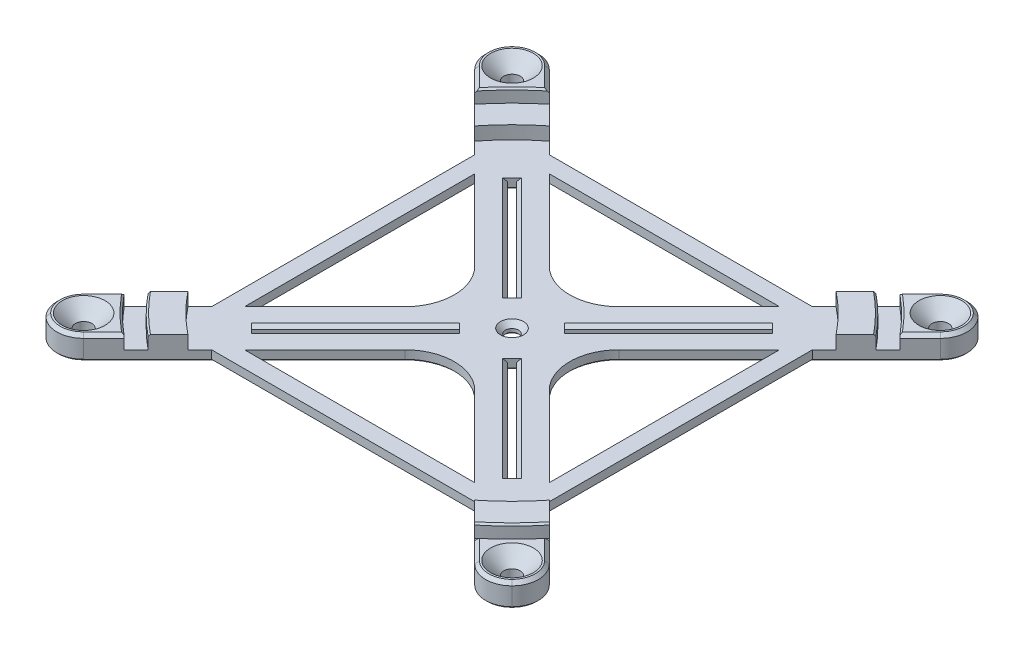
from build123d import *

# Parameters (mm, degrees)
EXTRUDE_1_DEPTH       = 14
EXTRUDE_2_DEPTH       = 14
FILLET_1_R            = 16
SKETCH_3_R            = 5
SKETCH_3_R_2          = 4
CUT_EXTRUDE_1_DEPTH   = 208.101215987
FILLET_2_R            = 30
SKETCH_4_R            = 167.2
SKETCH_4_R_2          = 157
CUT_EXTRUDE_1_2_DEPTH = 8
CHAMFER_2_SIZE        = 1
SKETCH_5_R            = 140
CUT_EXTRUDE_2_DEPTH   = 8
CHAMFER_3_SIZE        = 8
CHAMFER_4_SIZE        = 2
CHAMFER_5_SIZE        = 3
CUT_EXTRUDE_4_DEPTH   = 207.782285661
CHAMFER_6_SIZE        = 2
SKETCH_9_W            = 172.613296279
SKETCH_9_H            = 10
SKETCH_9_W_2          = 10
SKETCH_9_H_2          = 172.613296279
EXTRUDE_3_DEPTH       = 6
CHAMFER_7_SIZE        = 1


with BuildPart() as part:
    # Эскиз1 → Бобышка-Вытянуть1 (new body)
    with BuildSketch(Plane(origin=(0, 0, 0), x_dir=(1, 0, 0), z_dir=(0, 1, 0))):
        Polygon((130.107647738, -152.735064736), (-152.735064736, 130.107647738), (-130.107647738, 152.735064736), (152.735064736, -130.107647738), align=None)
    extrude(amount=EXTRUDE_1_DEPTH)

    # Эскиз2 → Бобышка-Вытянуть2 (add)
    with BuildSketch(Plane(origin=(0, 0, 0), x_dir=(1, 0, 0), z_dir=(0, 1, 0))):
        Polygon((-152.735064736, -130.107647738), (130.107647738, 152.735064736), (152.735064736, 130.107647738), (-130.107647738, -152.735064736), align=None)
    extrude(amount=EXTRUDE_2_DEPTH)

    # Скругление1
    fillet_1_edges = [part.edges().sort_by_distance(p)[0] for p in [
        (-130.107647738, 7, -152.735064736),
        (-152.735064736, 7, -130.107647738),
        (130.107647738, 7, 152.735064736),
        (152.735064736, 7, 130.107647738),
        (-130.107647738, 7, 152.735064736),
        (-152.735064736, 7, 130.107647738),
        (130.107647738, 7, -152.735064736),
        (152.735064736, 7, -130.107647738),
    ]]
    fillet(fillet_1_edges, radius=FILLET_1_R - 0.0001)  # a hair under: the kernel refuses the full size

    # Эскиз3 → Cut-Extrude 1 (cut, through all)
    with BuildSketch(Plane(origin=(0, 14, 0), x_dir=(1, 0, 0), z_dir=(0, 1, 0))):
        with Locations(Location((-130, -130, 0), (0, 0, 270))):
            Circle(SKETCH_3_R)
        with Locations(Location((-130, 130, 0), (0, 0, 270))):
            Circle(SKETCH_3_R)
        with Locations(Location((130, 130, 0), (0, 0, 270))):
            Circle(SKETCH_3_R)
        with Locations(Location((130, -130, 0), (0, 0, 270))):
            Circle(SKETCH_3_R)
        with Locations(Location((0, 0, 0), (0, 0, 270))):
            Circle(SKETCH_3_R_2)
    extrude(amount=-CUT_EXTRUDE_1_DEPTH, mode=Mode.SUBTRACT)

    # Скругление2
    fillet_2_edges = [part.edges().sort_by_distance(p)[0] for p in [
        (22.627416998, 7, 0),
        (0, 7, 22.627416998),
        (0, 7, -22.627416998),
        (-22.627416998, 7, 0),
    ]]
    fillet(fillet_2_edges, radius=FILLET_2_R)

    # Эскиз4 → Cut-Extrude 1 2 (cut)
    with BuildSketch(Plane(origin=(0, 14, 0), x_dir=(1, 0, 0), z_dir=(0, 1, 0))):
        Circle(SKETCH_4_R)
        Circle(SKETCH_4_R_2, mode=Mode.SUBTRACT)
    extrude(amount=-CUT_EXTRUDE_1_2_DEPTH, mode=Mode.SUBTRACT)

    # Фаска2
    chamfer_2_edges = [part.edges().sort_by_distance(p)[0] for p in [
        (118.228253814, 14, 118.228253814),
        (-118.228253814, 14, -118.228253814),
        (-118.228253814, 14, 118.228253814),
        (118.228253814, 14, -118.228253814),
        (111.015764646, 14, 111.015764646),
        (-111.015764646, 14, -111.015764646),
        (-111.015764646, 14, 111.015764646),
        (111.015764646, 14, -111.015764646),
    ]]
    chamfer(chamfer_2_edges, length=CHAMFER_2_SIZE)

    # Эскиз5 → Вырез-Вытянуть2 (cut)
    with BuildSketch(Plane(origin=(0, 14, 0), x_dir=(1, 0, 0), z_dir=(0, 1, 0))):
        Circle(SKETCH_5_R)
    extrude(amount=-CUT_EXTRUDE_2_DEPTH, mode=Mode.SUBTRACT)

    # Фаска3
    chamfer_3_edges = [part.edges().sort_by_distance(p)[0] for p in [
        (130, 14, 125),
        (130, 14, -135),
        (-130, 14, -135),
        (-130, 14, 125),
    ]]
    chamfer(chamfer_3_edges, length=CHAMFER_3_SIZE)

    # Фаска4
    chamfer_4_edges = [part.edges().sort_by_distance(p)[0] for p in [
        (-112.938165895, 14, -135.565582893),
        (-130.107647738, 14, -146.10768916),
        (-135.565582893, 14, -112.938165895),
        (-146.10768916, 14, -130.107647738),
        (112.938165895, 14, -135.565582893),
        (135.565582893, 14, -112.938165895),
        (130.107647738, 14, -146.10768916),
        (146.10768916, 14, -130.107647738),
        (-135.565582893, 14, 112.938165895),
        (-146.10768916, 14, 130.107647738),
        (-112.938165895, 14, 135.565582893),
        (-130.107647738, 14, 146.10768916),
        (112.938165895, 14, 135.565582893),
        (130.107647738, 14, 146.10768916),
        (135.565582893, 14, 112.938165895),
        (146.10768916, 14, 130.107647738),
    ]]
    chamfer(chamfer_4_edges, length=CHAMFER_4_SIZE)

    # Фаска5
    chamfer_5_edges = [part.edges().sort_by_distance(p)[0] for p in [
        (0, 6, -4),
    ]]
    chamfer(chamfer_5_edges, length=CHAMFER_5_SIZE)

    # Эскиз8 → Вырез-Вытянуть4 (cut, through all)
    with BuildSketch(Plane(origin=(0, 6, 0), x_dir=(1, 0, 0), z_dir=(0, 1, 0))):
        Polygon((14.516290338, 17.344717463), (77.659021124, 80.487448249), (80.487448249, 77.659021124), (17.344717463, 14.516290338), align=None)
        Polygon((17.344717463, -14.516290338), (80.487448249, -77.659021124), (77.659021124, -80.487448249), (14.516290338, -17.344717463), align=None)
        Polygon((-14.516290338, -17.344717463), (-77.659021124, -80.487448249), (-80.487448249, -77.659021124), (-17.344717463, -14.516290338), align=None)
        Polygon((-17.344717463, 14.516290338), (-80.487448249, 77.659021124), (-77.659021124, 80.487448249), (-14.516290338, 17.344717463), align=None)
    extrude(amount=-CUT_EXTRUDE_4_DEPTH, mode=Mode.SUBTRACT)

    # Фаска6
    chamfer_6_edges = [part.edges().sort_by_distance(p)[0] for p in [
        (-46.087655731, 6, -48.916082856),
        (-48.916082856, 6, -46.087655731),
        (-48.916082856, 6, 46.087655731),
        (-46.087655731, 6, 48.916082856),
        (46.087655731, 6, 48.916082856),
        (48.916082856, 6, 46.087655731),
        (48.916082856, 6, -46.087655731),
        (46.087655731, 6, -48.916082856),
    ]]
    chamfer(chamfer_6_edges, length=CHAMFER_6_SIZE)

    # Эскиз9 → Бобышка-Вытянуть3 (add)
    with BuildSketch(Plane(origin=(0, 6, 0), x_dir=(1, 0, 0), z_dir=(0, 1, 0))):
        with Locations((0.14392075, 97.496971679)):
            Rectangle(SKETCH_9_W, SKETCH_9_H)
        with Locations((97.496971679, -0.14392075)):
            Rectangle(SKETCH_9_W_2, SKETCH_9_H_2)
        with Locations((-0.14392075, -97.496971679)):
            Rectangle(SKETCH_9_W, SKETCH_9_H)
        with Locations((-97.496971679, 0.14392075)):
            Rectangle(SKETCH_9_W_2, SKETCH_9_H_2)
    extrude(amount=-EXTRUDE_3_DEPTH)

    # Фаска7
    chamfer_7_edges = [part.edges().sort_by_distance(p)[0] for p in [
        (68.168796056, 0, -45.541379058),
        (45.541379058, 0, 68.168796056),
        (-68.168796056, 0, 45.541379058),
        (-45.541379058, 0, -68.168796056),
        (35.053823869, 0, 0),
        (0, 0, 35.053823869),
        (-35.053823869, 0, 0),
        (0, 0, -35.053823869),
        (-15.930503901, 0, -15.930503901),
        (-48.916082856, 0, -46.087655731),
        (-79.073234687, 0, -79.073234687),
        (-46.087655731, 0, -48.916082856),
        (-15.930503901, 0, 15.930503901),
        (-46.087655731, 0, 48.916082856),
        (-79.073234687, 0, 79.073234687),
        (-48.916082856, 0, 46.087655731),
        (15.930503901, 0, 15.930503901),
        (48.916082856, 0, 46.087655731),
        (79.073234687, 0, 79.073234687),
        (46.087655731, 0, 48.916082856),
        (-99.331782316, 0, 121.959199314),
        (15.930503901, 0, -15.930503901),
        (46.087655731, 0, -48.916082856),
        (79.073234687, 0, -79.073234687),
        (48.916082856, 0, -46.087655731),
        (99.331782316, 0, -121.959199314),
        (121.959199314, 0, 99.331782316),
        (-121.959199314, 0, -99.331782316),
        (-146.10768916, 0, -130.107647738),
        (-130.107647738, 0, -146.10768916),
        (146.10768916, 0, 130.107647738),
        (130.107647738, 0, 146.10768916),
        (146.10768916, 0, -130.107647738),
        (130.107647738, 0, -146.10768916),
        (-146.10768916, 0, 130.107647738),
        (-130.107647738, 0, 146.10768916),
        (45.541379058, 0, -68.168796056),
        (-99.331782316, 0, -121.959199314),
        (0, 0, -102.496971679),
        (0, 0, -92.496971679),
        (121.959199314, 0, -99.331782316),
        (68.168796056, 0, 45.541379058),
        (102.496971679, 0, 0),
        (92.496971679, 0, 0),
        (-45.541379058, 0, 68.168796056),
        (99.331782316, 0, 121.959199314),
        (0, 0, 102.496971679),
        (0, 0, 92.496971679),
        (-121.959199314, 0, 99.331782316),
        (-68.168796056, 0, -45.541379058),
        (-102.496971679, 0, 0),
        (-92.496971679, 0, 0),
        (130, 0, 125),
        (130, 0, -135),
        (-130, 0, -135),
        (0, 0, -4),
        (-130, 0, 125),
    ]]
    chamfer(chamfer_7_edges, length=CHAMFER_7_SIZE)


solid = part.part
